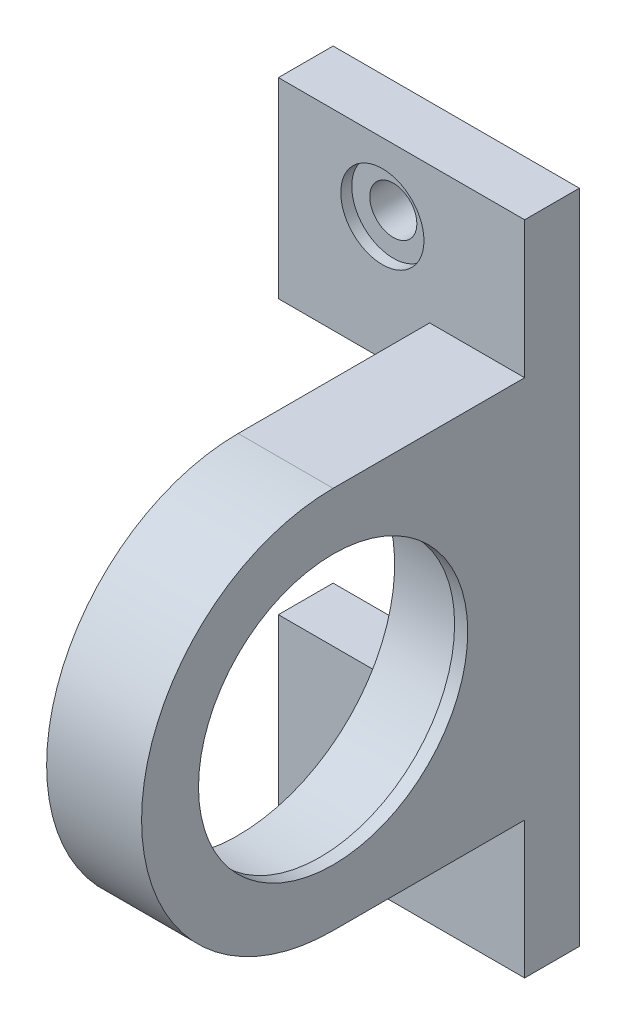
from build123d import *

# Parameters (mm, degrees)
SKETCH_2_W                     = 45
SKETCH_2_H                     = 60
SKETCH_2_W_2                   = 27.647058823
SKETCH_2_H_2                   = 25
EXTRUDE_2_DEPTH                = 5
SKETCH_4_W                     = 8.676470589
SKETCH_4_H                     = 35
SKETCH_4_W_2                   = 8.676470588
EXTRUDE_15_DEPTH               = 35
CUT_EXTRUDE_1_DEPTH            = 45
SKETCH_6_R                     = 14.3
CUT_EXTRUDE_2_DEPTH            = 45
FILLET_1_R                     = 5
SKETCH_7_R                     = 15
SKETCH_7_R_2                   = 13
EXTRUDE_16_DEPTH               = 1
SPLIT_BODIES_1_SURFACE_1_BACK  = 86
SPLIT_BODIES_1_SURFACE_1_DEPTH = 172
SPLIT_BODIES_1_SURFACE_2_BACK  = 86
SPLIT_BODIES_1_SURFACE_2_DEPTH = 172
HOLE_WIZARD_1_D                = 4.3
HOLE_WIZARD_1_DEPTH            = 5
HOLE_WIZARD_1_CBORE_D          = 7.6
HOLE_WIZARD_1_CBORE_DEPTH      = 1
HOLE_WIZARD_1_TIP              = 1.291850331
EXTRUDE_START                  = -1.2
SKETCH_14_R                    = 14.3
SKETCH_14_R_2                  = 12.3
EXTRUDE_1_DEPTH                = 1.2


with BuildPart() as part:
    # 草图2 → 凸台-拉伸2 (new body)
    with BuildSketch(Plane.XY):
        with Locations((7.726423565, -5.661764706)):
            Rectangle(SKETCH_2_W, SKETCH_2_H)
        with Locations((7.726423565, -5.661764706)):
            Rectangle(SKETCH_2_W_2, SKETCH_2_H_2, mode=Mode.SUBTRACT)
    extrude(amount=EXTRUDE_2_DEPTH)

    # 草图4 → 凸台-拉伸15 (add)
    with BuildSketch(Plane.XY.offset(5)):
        with Locations((-10.435341141, -5.661764706)):
            Rectangle(SKETCH_4_W, SKETCH_4_H)
        with Locations((25.888188271, -5.661764706)):
            Rectangle(SKETCH_4_W_2, SKETCH_4_H)
    extrude(amount=EXTRUDE_15_DEPTH)

    # 草图5 → 切除-拉伸1 (cut)
    with BuildSketch(Plane.ZY.offset(14.773576435)):
        with BuildLine():
            ThreePointArc((22.5, 11.838235294), (34.874368671, 6.712603965), (40, -5.661764706))
            Line((40, -5.661764706), (40, 11.838235294))
            Line((40, 11.838235294), (22.5, 11.838235294))
        make_face()
        with BuildLine():
            Line((40, -23.161764706), (40, -5.661764706))
            ThreePointArc((40, -5.661764706), (34.874368671, -18.036133377), (22.5, -23.161764706))
            Line((22.5, -23.161764706), (40, -23.161764706))
        make_face()
    extrude(amount=-CUT_EXTRUDE_1_DEPTH, mode=Mode.SUBTRACT)

    # 草图6 → 切除-拉伸2 (cut)
    with BuildSketch(Plane.ZY.offset(14.773576435)):
        with Locations((22.5, -5.661764706)):
            Circle(SKETCH_6_R)
    extrude(amount=-CUT_EXTRUDE_2_DEPTH, mode=Mode.SUBTRACT)

    # 圆角1
    fillet_1_edges = [part.edges().sort_by_distance(p)[0] for p in [
        (-6.097105846, 6.838235294, 2.5),
        (21.549952977, 6.838235294, 2.5),
        (-6.097105846, -18.161764706, 2.5),
        (21.549952977, -18.161764706, 2.5),
    ]]
    fillet(fillet_1_edges, radius=FILLET_1_R)

    # 草图7 → 凸台-拉伸16 (add)
    with BuildSketch(Plane(origin=(-6.097105846, 0, 0), x_dir=(0, 0, -1), z_dir=(1, 0, 0))):
        with Locations((-22.5, -5.661764706)):
            Circle(SKETCH_7_R)
        with Locations((-22.5, -5.661764706)):
            Circle(SKETCH_7_R_2, mode=Mode.SUBTRACT)
    extrude(amount=-EXTRUDE_16_DEPTH)


with BuildPart() as body_2:
    # Split Bodies 1: the piece behind the surface
    add(part.part)
    # Split Bodies 1 surface: a surface, the sketch's curves swept straight by 172 mm
    with BuildLine(Plane.XY.offset(5).offset(-SPLIT_BODIES_1_SURFACE_1_BACK), mode=Mode.PRIVATE) as split_bodies_1_surface_1_path:
        Line((7.726423565, 24.338235294), (7.726423565, -35.661764706))
    split_bodies_1_surface_1 = Shell.extrude(split_bodies_1_surface_1_path.wire(), (0 * SPLIT_BODIES_1_SURFACE_1_DEPTH, 0 * SPLIT_BODIES_1_SURFACE_1_DEPTH, 1 * SPLIT_BODIES_1_SURFACE_1_DEPTH))
    split(bisect_by=split_bodies_1_surface_1, keep=Keep.BOTTOM)


with BuildPart() as part_1:
    add(part.part)

    # Split Bodies 1: split by a surface, the side it looks to stays
    # Split Bodies 1 surface: a surface, the sketch's curves swept straight by 172 mm
    with BuildLine(Plane.XY.offset(5).offset(-SPLIT_BODIES_1_SURFACE_2_BACK), mode=Mode.PRIVATE) as split_bodies_1_surface_2_path:
        Line((7.726423565, 24.338235294), (7.726423565, -35.661764706))
    split_bodies_1_surface_2 = Shell.extrude(split_bodies_1_surface_2_path.wire(), (0 * SPLIT_BODIES_1_SURFACE_2_DEPTH, 0 * SPLIT_BODIES_1_SURFACE_2_DEPTH, 1 * SPLIT_BODIES_1_SURFACE_2_DEPTH))
    split(bisect_by=split_bodies_1_surface_2, keep=Keep.TOP)

    # 打孔尺寸(%根据六角头螺)栓 全螺纹的类型1
    with Locations(Plane(origin=(17.226423565, 18.088235294, 5), x_dir=(1, 0, 0), z_dir=(0, 0, 1))):
        with Locations((0, 0), (0, -47.5)):
            CounterBoreHole(HOLE_WIZARD_1_D / 2, HOLE_WIZARD_1_CBORE_D / 2, HOLE_WIZARD_1_CBORE_DEPTH, depth=HOLE_WIZARD_1_DEPTH)
            with Locations((0, 0, -(HOLE_WIZARD_1_DEPTH + HOLE_WIZARD_1_TIP / 2))):  # 118° drill point
                Cone(0, HOLE_WIZARD_1_D / 2, HOLE_WIZARD_1_TIP, mode=Mode.SUBTRACT)

    # 草图14 → 拉伸-薄壁1 (add)
    with BuildSketch(Plane(origin=(30.226423565, 0, 0), x_dir=(0, 0, -1), z_dir=(1, 0, 0)).offset(EXTRUDE_START)):
        with Locations((-22.5, -5.661764706)):
            Circle(SKETCH_14_R)
        with Locations((-22.5, -5.661764706)):
            Circle(SKETCH_14_R_2, mode=Mode.SUBTRACT)
    extrude(amount=EXTRUDE_1_DEPTH)


solid = part_1.part
